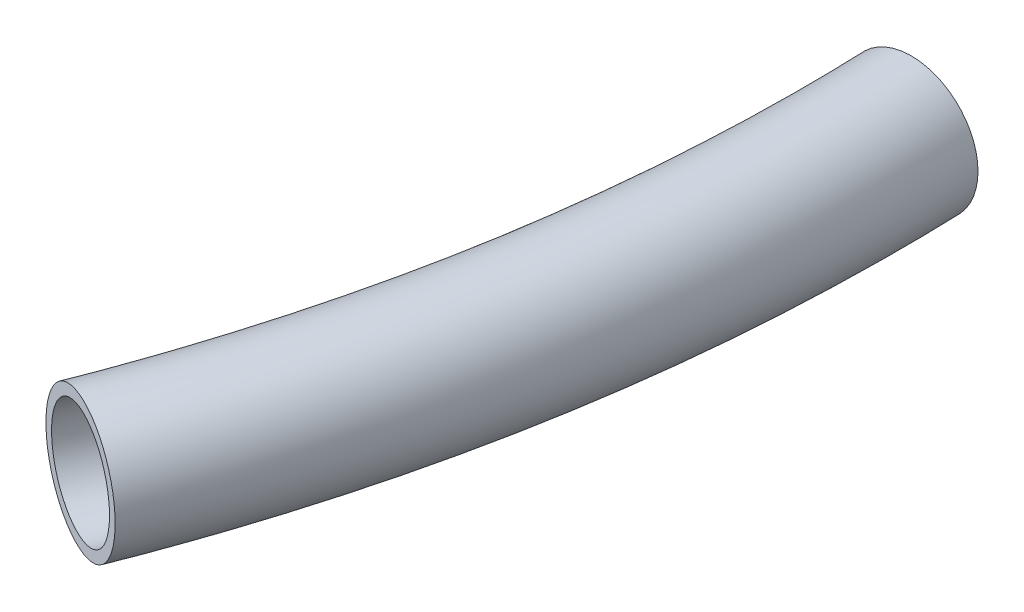
from build123d import *

# Parameters (mm, degrees)
SKETCH1_R          = 0.622
SKETCH1_R_2        = 0.520614
SKETCH9_R          = 0.2
CUT_EXTRUDE2_DEPTH = 10


with BuildPart() as part:
    # Sweep2: sweep along a path in Sketch2
    with BuildLine(Plane(origin=(0, 0, 0), x_dir=(1, 0, 0), z_dir=(0, 1, 0))) as sweep2_path:
        ThreePointArc((0.618604416, 0), (0.381986928, -3.496328816), (-0.560824063, -6.871445178))
    # Sketch1 → Sweep2 (sweep)
    with BuildSketch(Plane.XY):
        Circle(SKETCH1_R)
        Circle(SKETCH1_R_2, mode=Mode.SUBTRACT)
    sweep(path=sweep2_path.line)

    # Sketch9 → Cut-Extrude2 (cut)
    with BuildSketch(Plane(origin=(-0.66059748, 0, -0.036262972), x_dir=(0.054811681399111335, 0, -0.9984967098504643), z_dir=(0.9984967098504645, 0, 0.05481168139911134))):
        with Locations((-5.775778758, 0)):
            Circle(SKETCH9_R)
    extrude(amount=-CUT_EXTRUDE2_DEPTH, mode=Mode.SUBTRACT)


solid = part.part
